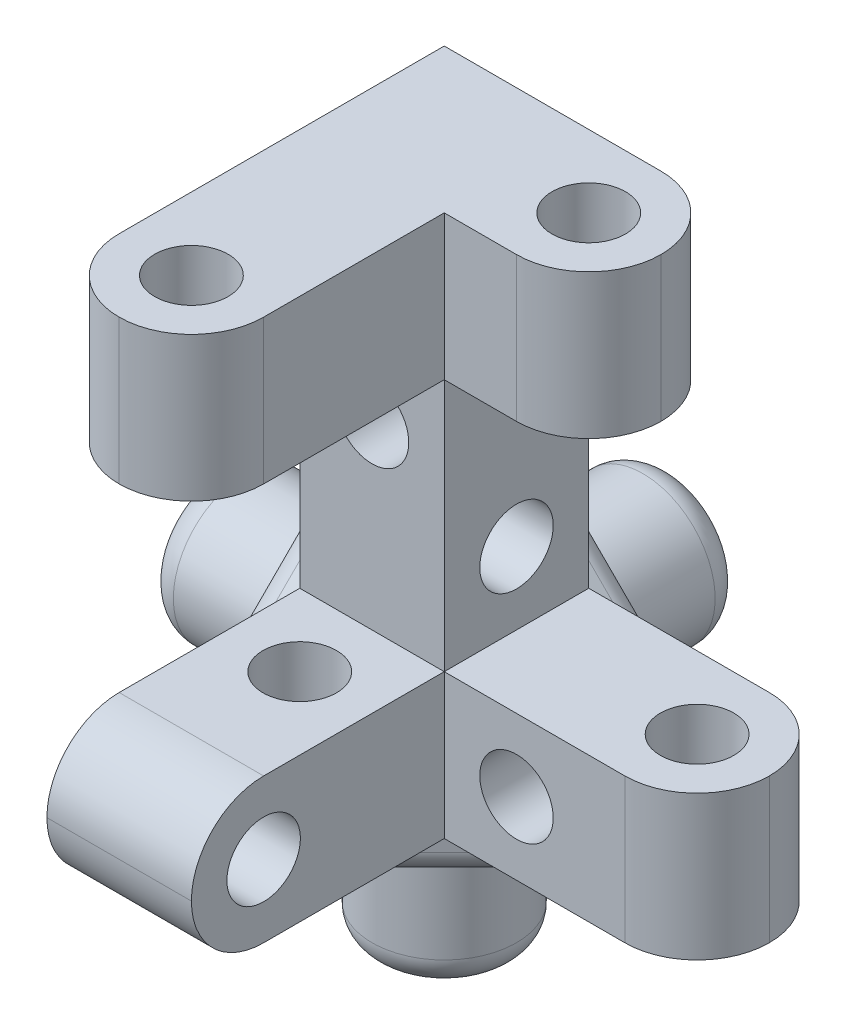
from build123d import *

# Parameters (mm, degrees)
SKETCH1_W                = 33
SKETCH1_H                = 33
BOSS_EXTRUDE1_DEPTH      = 33
SKETCH2_W                = 21
SKETCH2_H                = 21
CUT_EXTRUDE1_DEPTH       = 58.15767665
SKETCH3_W                = 21
SKETCH3_H                = 21
CUT_EXTRUDE2_DEPTH       = 58.15767665
SKETCH4_W                = 21
SKETCH4_H                = 21
CUT_EXTRUDE3_DEPTH       = 58.15767665
SKETCH5_R                = 3.05
CUT_EXTRUDE4_DEPTH       = 58.15767665
SKETCH6_R                = 3.05
CUT_EXTRUDE5_DEPTH       = 58.15767665
SKETCH7_R                = 3.05
CUT_EXTRUDE6_DEPTH       = 58.15767665
BOSS_EXTRUDE7_DEPTH      = 12
CUT_EXTRUDE7_REACH       = 66.831
SKETCH14_R               = 3.05
FILLET1_R                = 6
CHAMFER1_START           = -1
CHAMFER1_OUTLINE_W       = 16
CHAMFER1_OUTLINE_H       = 18
CHAMFER1_DEPTH           = 6.773502692
BOSS_EXTRUDE3_DEPTH      = 8
BOSS_EXTRUDE3_DEPTH_BACK = 10
SKETCH9_W                = 18
SKETCH9_H                = 18
CHAMFER2_SIZE            = 6
FILLET2_R                = 1.25
SKETCH10_R               = 6
BOSS_EXTRUDE4_DEPTH      = 10
SKETCH11_R               = 6
BOSS_EXTRUDE5_DEPTH      = 10
SKETCH12_R               = 6
BOSS_EXTRUDE6_DEPTH      = 10
FILLET3_R                = 2
FILLET4_R                = 2.5


with BuildPart() as part:
    # Sketch1 → Boss-Extrude1 (new body)
    with BuildSketch(Plane(origin=(0, 0, 0), x_dir=(1, 0, 0), z_dir=(0, 1, 0))):
        with Locations((16.5, -16.5)):
            Rectangle(SKETCH1_W, SKETCH1_H)
    extrude(amount=BOSS_EXTRUDE1_DEPTH)

    # Sketch2 → Cut-Extrude1 (cut, through all)
    with BuildSketch(Plane.XY.offset(33)):
        with Locations((22.5, 22.5)):
            Rectangle(SKETCH2_W, SKETCH2_H)
    extrude(amount=-CUT_EXTRUDE1_DEPTH, mode=Mode.SUBTRACT)

    # Sketch3 → Cut-Extrude2 (cut, through all)
    with BuildSketch(Plane.XZ):
        with Locations((22.5, 22.5)):
            Rectangle(SKETCH3_W, SKETCH3_H)
    extrude(amount=-CUT_EXTRUDE2_DEPTH, mode=Mode.SUBTRACT)

    # Sketch4 → Cut-Extrude3 (cut, through all)
    with BuildSketch(Plane.ZY):
        with Locations((22.5, 22.5)):
            Rectangle(SKETCH4_W, SKETCH4_H)
    extrude(amount=-CUT_EXTRUDE3_DEPTH, mode=Mode.SUBTRACT)

    # Sketch5 → Cut-Extrude4 (cut, through all)
    with BuildSketch(Plane.ZY):
        with Locations((27, 6)):
            Circle(SKETCH5_R)
        with Locations((6, 18)):
            Circle(SKETCH5_R)
    extrude(amount=-CUT_EXTRUDE4_DEPTH, mode=Mode.SUBTRACT)

    # Sketch6 → Cut-Extrude5 (cut, through all)
    with BuildSketch(Plane.XZ):
        with Locations(Location((6, 18, 0), (0, 0, 270))):
            Circle(SKETCH6_R)
        with Locations(Location((27, 6, 0), (0, 0, 270))):
            Circle(SKETCH6_R)
    extrude(amount=-CUT_EXTRUDE5_DEPTH, mode=Mode.SUBTRACT)

    # Sketch7 → Cut-Extrude6 (cut, through all)
    with BuildSketch(Plane(origin=(0, 0, 0), x_dir=(-1, 0, 0), z_dir=(0, 0, -1))):
        with Locations((-18, 6)):
            Circle(SKETCH7_R)
        with Locations((-6, 27)):
            Circle(SKETCH7_R)
    extrude(amount=-CUT_EXTRUDE6_DEPTH, mode=Mode.SUBTRACT)

    # Sketch13 → Boss-Extrude7 (add)
    with BuildSketch(Plane(origin=(0, 33, 0), x_dir=(1, 0, 0), z_dir=(0, 1, 0))):
        Polygon((24, 0), (24, -12), (12, -12), (12, -33), (0, -33), (0, 0), align=None)
    extrude(amount=BOSS_EXTRUDE7_DEPTH)

    # Sketch14 → Cut-Extrude7 (cut, up to next)
    with BuildSketch(Plane(origin=(0, 45, 0), x_dir=(1, 0, 0), z_dir=(0, 1, 0)), mode=Mode.PRIVATE) as cut_extrude7_sk1:
        with Locations(Location((18, -6, 0), (0, 0, 270))):
            Circle(SKETCH14_R)
    cut_extrude7_tool1 = extrude(cut_extrude7_sk1.sketch, amount=-CUT_EXTRUDE7_REACH, mode=Mode.PRIVATE) & part.part
    # Sketch14 → Cut-Extrude7 (cut, up to next)
    with BuildSketch(Plane(origin=(0, 45, 0), x_dir=(1, 0, 0), z_dir=(0, 1, 0)), mode=Mode.PRIVATE) as cut_extrude7_sk2:
        with Locations(Location((6, -27, 0), (0, 0, 270))):
            Circle(SKETCH14_R)
    cut_extrude7_tool2 = extrude(cut_extrude7_sk2.sketch, amount=-CUT_EXTRUDE7_REACH, mode=Mode.PRIVATE) & part.part
    add(cut_extrude7_tool1.solids().sort_by_distance((18, 45, 6))[0], mode=Mode.SUBTRACT)
    add(cut_extrude7_tool2.solids().sort_by_distance((6, 45, 27))[0], mode=Mode.SUBTRACT)

    # Fillet1
    fillet1_edges = [part.edges().sort_by_distance(p)[0] for p in [
        (6, 12, 33),
        (6, 0, 33),
        (33, 6, 0),
        (33, 6, 12),
        (24, 39, 0),
        (24, 39, 12),
        (0, 39, 33),
        (12, 39, 33),
    ]]
    fillet(fillet1_edges, radius=FILLET1_R - 0.0001)  # a hair under: the kernel refuses the full size

    # Chamfer1: read off the stored shape, not the designer's step
    # Chamfer1 outline → Chamfer1 (cut)
    with BuildSketch(Plane(origin=(0, 0, 0), x_dir=(0.8164965809277258, -0.40824829046386313, -0.40824829046386313), z_dir=(0.5773502691896258, 0.5773502691896258, 0.5773502691896258)).offset(CHAMFER1_START)):
        with Locations((2, 0)):
            Rectangle(CHAMFER1_OUTLINE_W, CHAMFER1_OUTLINE_H)
    extrude(amount=CHAMFER1_DEPTH, mode=Mode.SUBTRACT)

    # Sketch9 → Boss-Extrude3 (add, two sides: drawn at the far end of the back side and taken through both)
    with BuildSketch(Plane(origin=(0, 0, 0), x_dir=(1, 0, 0), z_dir=(0, 1, 0)).offset(-BOSS_EXTRUDE3_DEPTH_BACK)):
        with Locations((-1, 1)):
            Rectangle(SKETCH9_W, SKETCH9_H)
    extrude(amount=BOSS_EXTRUDE3_DEPTH + BOSS_EXTRUDE3_DEPTH_BACK)

    # Chamfer2
    chamfer2_edges = [part.edges().sort_by_distance(p)[0] for p in [
        (8, -5, 8),
        (8, 8, -5),
        (-5, 8, 8),
    ]]
    chamfer(chamfer2_edges, length=CHAMFER2_SIZE)

    # Fillet2
    # the kernel refuses this fillet: 1.25 mm, written as the material it adds along each edge
    with BuildSketch(Plane(origin=(-4.268829387, 8, 6.268829387), x_dir=(-0.408248290463863, 0.816496580927726, -0.408248290463863), z_dir=(0.7071067811865476, 0, -0.7071067811865476))) as fillet2_piece_1_section:
        with BuildLine():
            CenterArc((FILLET2_R * 1.93185165258, -FILLET2_R), FILLET2_R, 90, 125.264389683)
            Line((FILLET2_R * 1.11535507165, -FILLET2_R * 1.57735026919), (0, 0))
            Line((0, 0), (FILLET2_R * 1.93185165258, 0))
        make_face()
    fillet2_piece_1 = extrude(amount=14.902499954, mode=Mode.PRIVATE)
    fillet2_piece_1 = split(fillet2_piece_1, bisect_by=Plane(origin=(-1.134414693, 11.134414693, 6.268829387), z_dir=(-0.7071067811865476, -0.7071067811865476, 0)), keep=Keep.TOP, mode=Mode.PRIVATE)
    fillet2_piece_1 = split(fillet2_piece_1, bisect_by=Plane(origin=(-4.268829387, 5.865585306, 4.134414694), z_dir=(0, -0.7071067811865476, -0.7071067811865476)), keep=Keep.TOP, mode=Mode.PRIVATE)
    add(fillet2_piece_1)
    with BuildSketch(Plane(origin=(-4.268829387, 6.268829387, 8), x_dir=(-0.4082482904638628, -0.4082482904638628, 0.8164965809277263), z_dir=(0.7071067811865476, -0.7071067811865476, 0))) as fillet2_piece_2_section:
        with BuildLine():
            CenterArc((FILLET2_R * 1.93185165258, FILLET2_R), FILLET2_R, 144.735610317, 125.264389683)
            Line((FILLET2_R * 1.11535507165, FILLET2_R * 1.57735026919), (0, 0))
            Line((0, 0), (FILLET2_R * 1.93185165258, 0))
        make_face()
    fillet2_piece_2 = extrude(amount=14.902499954, mode=Mode.PRIVATE)
    fillet2_piece_2 = split(fillet2_piece_2, bisect_by=Plane(origin=(-4.268829387, 4.134414694, 5.865585306), z_dir=(0, -0.7071067811865476, -0.7071067811865476)), keep=Keep.TOP, mode=Mode.PRIVATE)
    fillet2_piece_2 = split(fillet2_piece_2, bisect_by=Plane(origin=(-1.134414693, 6.268829387, 11.134414693), z_dir=(-0.7071067811865476, 0, -0.7071067811865475)), keep=Keep.TOP, mode=Mode.PRIVATE)
    add(fillet2_piece_2)
    with BuildSketch(Plane(origin=(8, -4.268829387, 6.268829387), x_dir=(0.8164965809277257, -0.40824829046386313, -0.4082482904638633), z_dir=(0, 0.7071067811865476, -0.7071067811865475))) as fillet2_piece_3_section:
        with BuildLine():
            CenterArc((FILLET2_R * 1.93185165258, FILLET2_R), FILLET2_R, 144.735610317, 125.264389683)
            Line((FILLET2_R * 1.11535507165, FILLET2_R * 1.57735026919), (0, 0))
            Line((0, 0), (FILLET2_R * 1.93185165258, 0))
        make_face()
    fillet2_piece_3 = extrude(amount=14.902499954, mode=Mode.PRIVATE)
    fillet2_piece_3 = split(fillet2_piece_3, bisect_by=Plane(origin=(11.134414693, -1.134414693, 6.268829387), z_dir=(-0.7071067811865476, -0.7071067811865476, 0)), keep=Keep.TOP, mode=Mode.PRIVATE)
    fillet2_piece_3 = split(fillet2_piece_3, bisect_by=Plane(origin=(5.865585306, -4.268829387, 4.134414694), z_dir=(-0.7071067811865476, 0, -0.7071067811865475)), keep=Keep.TOP, mode=Mode.PRIVATE)
    add(fillet2_piece_3)

    # Sketch10 → Boss-Extrude4 (add)
    with BuildSketch(Plane.XZ.offset(10)):
        with Locations(Location((-1, -1, 0), (0, 0, 270))):
            Circle(SKETCH10_R)
    extrude(amount=BOSS_EXTRUDE4_DEPTH)

    # Sketch11 → Boss-Extrude5 (add)
    with BuildSketch(Plane.ZY.offset(10)):
        with Locations((-1, -1)):
            Circle(SKETCH11_R)
    extrude(amount=BOSS_EXTRUDE5_DEPTH)

    # Sketch12 → Boss-Extrude6 (add)
    with BuildSketch(Plane(origin=(0, 0, -10), x_dir=(-1, 0, 0), z_dir=(0, 0, -1))):
        with Locations((1, -1)):
            Circle(SKETCH12_R)
    extrude(amount=BOSS_EXTRUDE6_DEPTH)

    # Fillet3
    fillet3_edges = [part.edges().sort_by_distance(p)[0] for p in [
        (8, -4, -10),
        (-4, -10, 8),
        (-10, 8, -4),
        (-10, -1, -10),
        (-4, 8, -10),
        (-10, -4, 8),
        (-10, -10, -1),
        (-1, -10, -10),
        (8, -10, -4),
        (5, -10, 5),
        (5, 5, -10),
        (-10, 5, 5),
    ]]
    fillet(fillet3_edges, radius=FILLET3_R)

    # Fillet4
    fillet4_edges = [part.edges().sort_by_distance(p)[0] for p in [
        (-1, -20, 5),
        (-20, -1, -7),
        (5, -1, -20),
    ]]
    fillet(fillet4_edges, radius=FILLET4_R)


solid = part.part
